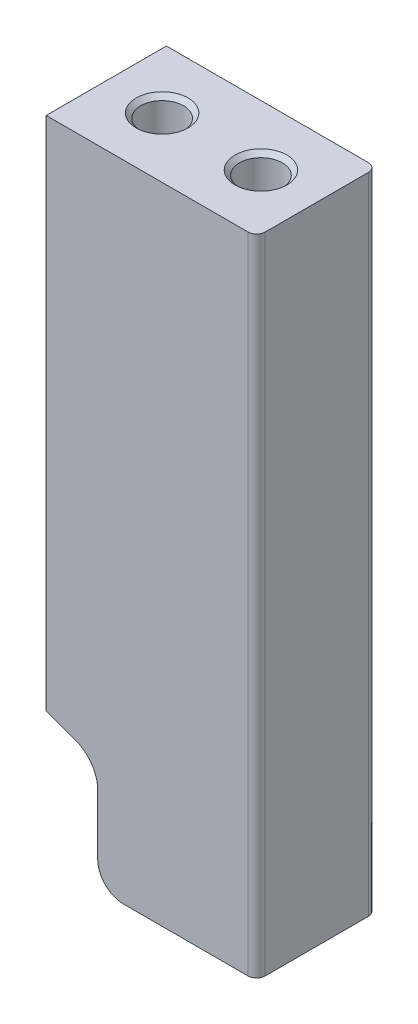
from build123d import *

# Parameters (mm, degrees)
SKETCH1_W                   = 24.5
SKETCH1_H                   = 14
BOSS_EXTRUDE1_DEPTH         = 75
CUT_EXTRUDE1_REACH          = 79.273
FILLET1_R                   = 3
FILLET2_R                   = 1
M6_TAPPED_HOLE1_D           = 5
M6_TAPPED_HOLE1_DEPTH       = 17
M6_TAPPED_HOLE1_CSINK_D     = 6.05
M6_TAPPED_HOLE1_CSINK_ANGLE = 90
M6_TAPPED_HOLE1_TIP         = 1.502151548


with BuildPart() as part:
    # Sketch1 → Boss-Extrude1 (new body)
    with BuildSketch(Plane(origin=(0, 0, 0), x_dir=(1, 0, 0), z_dir=(0, 1, 0))):
        Rectangle(SKETCH1_W, SKETCH1_H)
    extrude(amount=-BOSS_EXTRUDE1_DEPTH)

    # Sketch2 → Cut-Extrude1 (cut, up to next)
    with BuildSketch(Plane.XY.offset(7), mode=Mode.PRIVATE) as cut_extrude1_sk1:
        with BuildLine():
            Line((-8.881919427, -61.241229517), (-12.25, -60.015348442))
            Line((-12.25, -60.015348442), (-12.25, -75))
            Line((-12.25, -75), (-6.25, -75))
            Line((-6.25, -75), (-6.25, -65))
            ThreePointArc((-6.25, -65), (-6.973391823, -62.705694255), (-8.881919427, -61.241229517))
        make_face()
    cut_extrude1_tool1 = extrude(cut_extrude1_sk1.sketch, amount=-CUT_EXTRUDE1_REACH, mode=Mode.PRIVATE) & part.part
    add(cut_extrude1_tool1.solids().sort_by_distance((-9.372504, -68.134359, 7))[0], mode=Mode.SUBTRACT)

    # Fillet1
    fillet1_edges = [part.edges().sort_by_distance(p)[0] for p in [
        (-6.25, -75, 0),
    ]]
    fillet(fillet1_edges, radius=FILLET1_R)

    # Fillet2
    fillet2_edges = [part.edges().sort_by_distance(p)[0] for p in [
        (12.25, -37.5, -7),
        (12.25, -37.5, 7),
    ]]
    fillet(fillet2_edges, radius=FILLET2_R)

    # M6 Tapped Hole1
    with Locations(Plane(origin=(0, 0, 0), x_dir=(1, 0, 0), z_dir=(0, 1, 0))):
        with Locations((-5.75, 0), (5.75, 0)):
            CounterSinkHole(M6_TAPPED_HOLE1_D / 2, M6_TAPPED_HOLE1_CSINK_D / 2, depth=M6_TAPPED_HOLE1_DEPTH, counter_sink_angle=M6_TAPPED_HOLE1_CSINK_ANGLE)
            with Locations((0, 0, -(M6_TAPPED_HOLE1_DEPTH + M6_TAPPED_HOLE1_TIP / 2))):  # 118° drill point
                Cone(0, M6_TAPPED_HOLE1_D / 2, M6_TAPPED_HOLE1_TIP, mode=Mode.SUBTRACT)


solid = part.part
